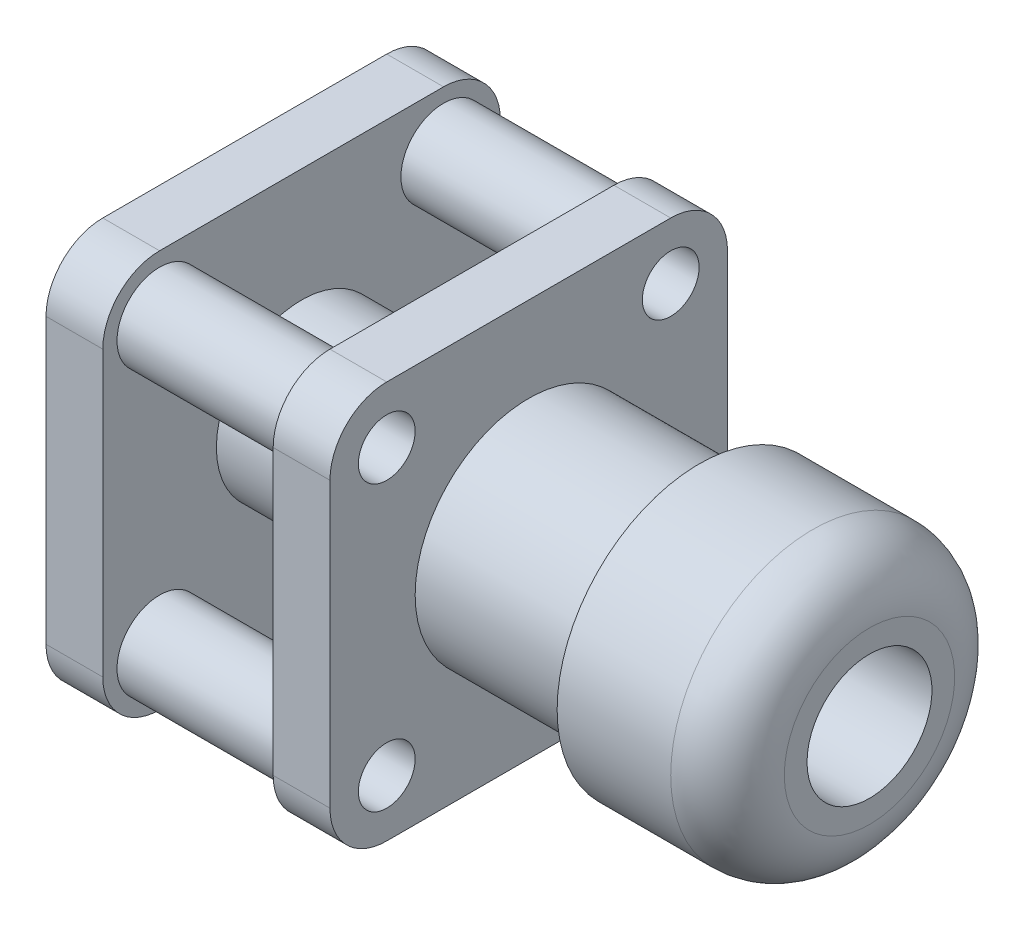
from build123d import *

# Parameters (mm, degrees)
SKETCH_2_R               = 7.5
EXTRUDE_1_DEPTH          = 10
EXTRUDE_START            = -40
SKETCH_2_3_R             = 7.5
EXTRUDE_2_DEPTH          = 10
SKETCH_3_R               = 7.5
SKETCH_3_R_2             = 5
SKETCH_3_R_3             = 11
EXTRUDE_3_DEPTH          = 50
CUT_EXTRUDE_2_DEPTH      = 121.623380818
CUT_EXTRUDE_2_DEPTH_BACK = 121.623380818
SKETCH_6_R               = 5
SKETCH_6_R_2             = 11


with BuildPart() as part:
    # Эскиз1 → Повернуть1 (revolve)
    with BuildSketch(Plane.XY):
        with BuildLine():
            Line((0, -11), (0, -35))
            Line((0, -35), (10, -35))
            Line((10, -35), (10, -15))
            Line((10, -15), (40, -15))
            Line((40, -15), (40, -35))
            Line((40, -35), (50, -35))
            Line((50, -35), (50, -20))
            Line((50, -20), (80, -20))
            Line((80, -20), (80, -25))
            Line((80, -25), (100, -25))
            ThreePointArc((100, -25), (107.071067812, -22.071067812), (110, -15))
            Line((110, -15), (110, -11))
            Line((110, -11), (0, -11))
        make_face()
    revolve(axis=Axis((0, 0, 0), (1, 0, 0)))

    # Эскиз2 → Бобышка-Вытянуть1 (add)
    with BuildSketch(Plane.ZY):
        with BuildLine():
            Line((-25, 35), (25, 35))
            ThreePointArc((25, 35), (32.071067812, 32.071067812), (35, 25))
            Line((35, 25), (35, -25))
            ThreePointArc((35, -25), (32.071067812, -32.071067812), (25, -35))
            Line((25, -35), (-25, -35))
            ThreePointArc((-25, -35), (-32.071067812, -32.071067812), (-35, -25))
            Line((-35, -25), (-35, 25))
            ThreePointArc((-35, 25), (-32.071067812, 32.071067812), (-25, 35))
        make_face()
        with Locations((25, 25)):
            Circle(SKETCH_2_R, mode=Mode.SUBTRACT)
        with Locations((-25, 25)):
            Circle(SKETCH_2_R, mode=Mode.SUBTRACT)
        with Locations((-25, -25)):
            Circle(SKETCH_2_R, mode=Mode.SUBTRACT)
        with Locations((25, -25)):
            Circle(SKETCH_2_R, mode=Mode.SUBTRACT)
    extrude(amount=-EXTRUDE_1_DEPTH)

    # Эскиз2<3> → Бобышка-Вытянуть2 (add)
    with BuildSketch(Plane.ZY.offset(EXTRUDE_START)):
        with BuildLine():
            Line((-25, 35), (25, 35))
            ThreePointArc((25, 35), (32.071067812, 32.071067812), (35, 25))
            Line((35, 25), (35, -25))
            ThreePointArc((35, -25), (32.071067812, -32.071067812), (25, -35))
            Line((25, -35), (-25, -35))
            ThreePointArc((-25, -35), (-32.071067812, -32.071067812), (-35, -25))
            Line((-35, -25), (-35, 25))
            ThreePointArc((-35, 25), (-32.071067812, 32.071067812), (-25, 35))
        make_face()
        with Locations((25, 25)):
            Circle(SKETCH_2_3_R, mode=Mode.SUBTRACT)
        with Locations((-25, 25)):
            Circle(SKETCH_2_3_R, mode=Mode.SUBTRACT)
        with Locations((-25, -25)):
            Circle(SKETCH_2_3_R, mode=Mode.SUBTRACT)
        with Locations((25, -25)):
            Circle(SKETCH_2_3_R, mode=Mode.SUBTRACT)
    extrude(amount=-EXTRUDE_2_DEPTH)

    # Эскиз3 → Бобышка-Вытянуть3 (add)
    # profile 1 of 5: a face of its own
    with BuildSketch(Plane.ZY):
        with Locations((-25, 25)):
            Circle(SKETCH_3_R)
        with Locations((-25, 25)):
            Circle(SKETCH_3_R_2, mode=Mode.SUBTRACT)
    # profile 2 of 5: a face of its own
    with BuildSketch(Plane.ZY):
        with Locations((25, 25)):
            Circle(SKETCH_3_R)
        with Locations((25, 25)):
            Circle(SKETCH_3_R_2, mode=Mode.SUBTRACT)
    # profile 3 of 5: a face of its own
    with BuildSketch(Plane.ZY):
        with Locations((-25, -25)):
            Circle(SKETCH_3_R)
        with Locations((-25, -25)):
            Circle(SKETCH_3_R_2, mode=Mode.SUBTRACT)
    # profile 4 of 5: a face of its own
    with BuildSketch(Plane.ZY):
        with Locations((25, -25)):
            Circle(SKETCH_3_R)
        with Locations((25, -25)):
            Circle(SKETCH_3_R_2, mode=Mode.SUBTRACT)
    # profile 5 of 5: a face of its own
    with BuildSketch(Plane.ZY):
        Circle(SKETCH_3_R_3)
    extrude(amount=-EXTRUDE_3_DEPTH)

    # Эскиз6 → Вырез-Вытянуть2 (cut, two sides: drawn at the far end of the back side and taken through both)
    with BuildSketch(Plane.ZY.offset(-CUT_EXTRUDE_2_DEPTH_BACK)):
        with Locations((-25, 25)):
            Circle(SKETCH_6_R)
        with Locations((-25, -25)):
            Circle(SKETCH_6_R)
        with Locations((25, 25)):
            Circle(SKETCH_6_R)
        with Locations((25, -25)):
            Circle(SKETCH_6_R)
        Circle(SKETCH_6_R_2)
    extrude(amount=CUT_EXTRUDE_2_DEPTH + CUT_EXTRUDE_2_DEPTH_BACK, mode=Mode.SUBTRACT)


solid = part.part
